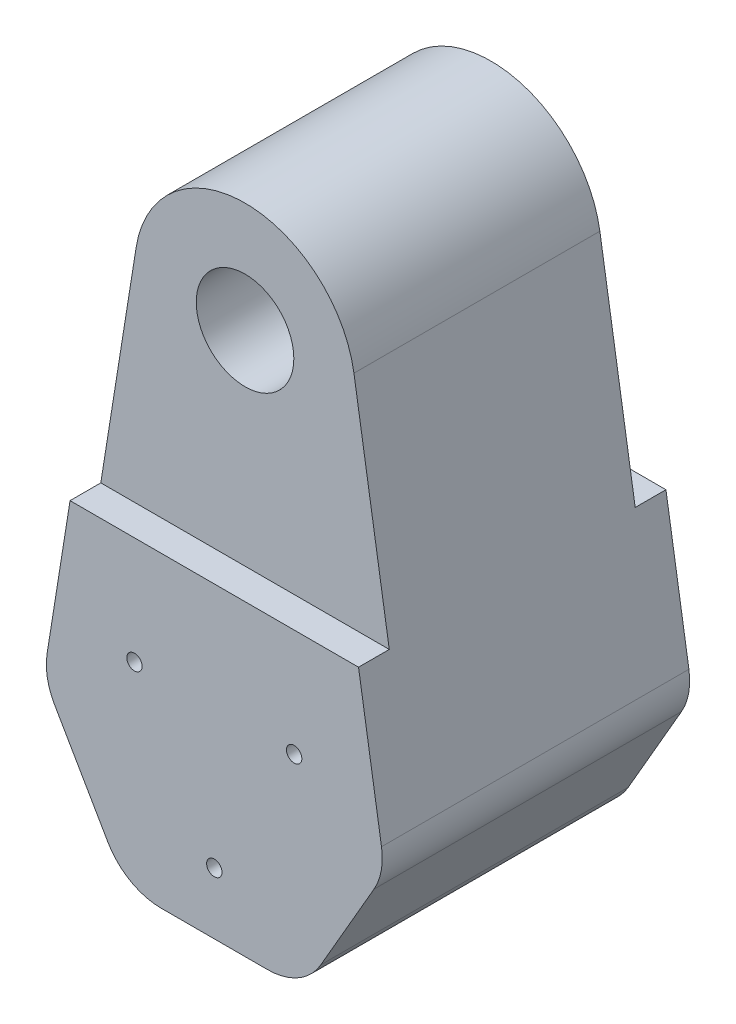
from build123d import *

# Parameters (mm, degrees)
SKETCH1_R           = 1.25
BOSS_EXTRUDE1_DEPTH = 25
SKETCH1_3_R         = 7.9375
BOSS_EXTRUDE2_DEPTH = 20


with BuildPart() as part:
    # Sketch1 → Boss-Extrude1 (new, symmetric)
    with BuildSketch(Plane.XY):
        with BuildLine():
            Line((23.460328237, -33.213203436), (-23.460328237, -33.213203436))
            Line((-23.460328237, -33.213203436), (-27.195743689, -56.638490264))
            ThreePointArc((-27.195743689, -56.638490264), (-27.154012409, -60.03039702), (-25.980762114, -63.213203436))
            Line((-25.980762114, -63.213203436), (-17.320508076, -78.213203436))
            ThreePointArc((-17.320508076, -78.213203436), (-13.660254038, -81.873457473), (-8.660254038, -83.213203436))
            Line((-8.660254038, -83.213203436), (8.660254038, -83.213203436))
            ThreePointArc((8.660254038, -83.213203436), (13.660254038, -81.873457473), (17.320508076, -78.213203436))
            Line((17.320508076, -78.213203436), (25.980762114, -63.213203436))
            ThreePointArc((25.980762114, -63.213203436), (27.154012409, -60.03039702), (27.195743689, -56.638490264))
            Line((27.195743689, -56.638490264), (23.460328237, -33.213203436))
        make_face()
        with Locations((0, -73.213203436)):
            Circle(SKETCH1_R, mode=Mode.SUBTRACT)
        with Locations((-12.990381057, -50.713203436)):
            Circle(SKETCH1_R, mode=Mode.SUBTRACT)
        with Locations((12.990381057, -50.713203436)):
            Circle(SKETCH1_R, mode=Mode.SUBTRACT)
    extrude(amount=BOSS_EXTRUDE1_DEPTH, both=True)

    # Sketch1<3> → Boss-Extrude2 (add, symmetric)
    with BuildSketch(Plane.XY):
        with BuildLine():
            ThreePointArc((17.713703882, 2.824641751), (0, 17.9375), (-17.713703882, 2.824641751))
            Line((-17.713703882, 2.824641751), (-23.460328237, -33.213203436))
            Line((-23.460328237, -33.213203436), (23.460328237, -33.213203436))
            Line((23.460328237, -33.213203436), (17.713703882, 2.824641751))
        make_face()
        Circle(SKETCH1_3_R, mode=Mode.SUBTRACT)
    extrude(amount=BOSS_EXTRUDE2_DEPTH, both=True)


solid = part.part
